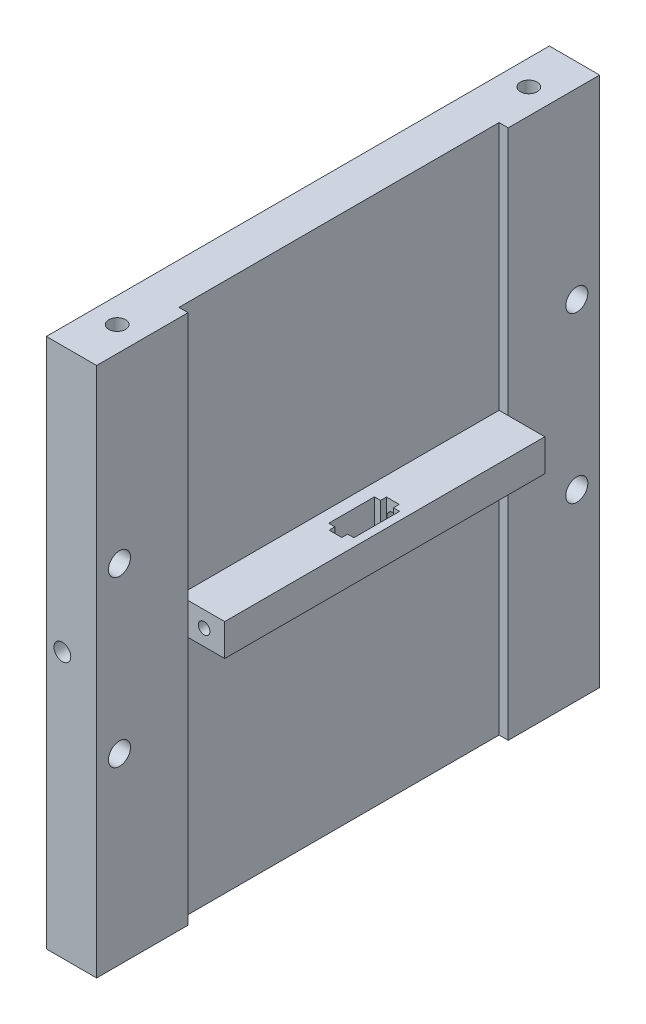
from build123d import *

# Parameters (mm, degrees)
SKETCH2_W              = 11
SKETCH2_H              = 116
BOSS_EXTRUDE2_DEPTH    = 109.999999964
SKETCH3_W              = 2
SKETCH3_H              = 70
CUT_EXTRUDE1_DEPTH     = 129.848748531
CUT_EXTRUDE2_DEPTH     = 7
CUT_EXTRUDE2_DRAFT     = -45
SKETCH6_W              = 70
SKETCH6_H              = 7
BOSS_EXTRUDE3_DEPTH    = 10
SKETCH7_R              = 1.27
CUT_EXTRUDE3_DEPTH     = 108.633637835
CUT_EXTRUDE4_DEPTH     = 84.23610994
CUT_EXTRUDE5_START     = -109.999999964
CUT_EXTRUDE5_OUTLINE_R = 1.8415
CUT_EXTRUDE5_DEPTH     = 109.999999964
SKETCH10_R             = 1.8415
CUT_EXTRUDE6_DEPTH     = 25.4
CUT_EXTRUDE7_START     = -25.4
SKETCH11_R             = 1.8415
CUT_EXTRUDE7_DEPTH     = 25.4
SKETCH12_R             = 2.413
CUT_EXTRUDE8_DEPTH     = 81.684571085


# Read off the part's stored shape, not the designer's step: Cut-Extrude5
with BuildPart() as part:
    # Sketch2 → Boss-Extrude2 (new body)
    with BuildSketch(Plane.XY.offset(54.999999982)):
        with Locations((-5.5, 0)):
            Rectangle(SKETCH2_W, SKETCH2_H)
    extrude(amount=-BOSS_EXTRUDE2_DEPTH)

    # Sketch3 → Cut-Extrude1 (cut, through all)
    with BuildSketch(Plane(origin=(0, 58, 0), x_dir=(1, 0, 0), z_dir=(0, 1, 0))):
        with Locations((-1, 1.8e-08)):
            Rectangle(SKETCH3_W, SKETCH3_H)
    extrude(amount=-CUT_EXTRUDE1_DEPTH, mode=Mode.SUBTRACT)


with BuildPart() as cut_extrude2_tool:
    # Sketch5 → Cut-Extrude2 (with draft: the straight prism first)
    with BuildSketch(Plane.ZY.offset(11)):
        with BuildLine():
            Line((-44.45, 0), (-44.45, -77.05))
            Line((-44.45, -77.05), (44.45, -77.05))
            Line((44.45, -77.05), (44.45, 0))
            ThreePointArc((44.45, 0), (0, 44.45), (-44.45, 0))
        make_face()
    extrude(amount=-CUT_EXTRUDE2_DEPTH)
    # Cut-Extrude2: the draft: its side faces are tilted about the plane it starts from
    cut_extrude2_sides = [cut_extrude2_tool.faces().sort_by_distance(p)[0] for p in [
        (-7.5, -38.525, -44.45),
        (-7.5, -77.05, 0),
        (-7.5, -38.525, 44.45),
        (-7.5, 44.45, 0),
    ]]
    draft(cut_extrude2_sides, Plane.ZY.offset(11), CUT_EXTRUDE2_DRAFT)


with BuildPart() as part_1:
    add(part.part)

    # Cut-Extrude2: cut by cut_extrude2_tool
    add(cut_extrude2_tool.part, mode=Mode.SUBTRACT)

    # Sketch6 → Boss-Extrude3 (add)
    with BuildSketch(Plane(origin=(-2, 0, 0), x_dir=(0, 0, -1), z_dir=(1, 0, 0))):
        with Locations((1.8e-08, 0)):
            Rectangle(SKETCH6_W, SKETCH6_H)
    extrude(amount=BOSS_EXTRUDE3_DEPTH)

    # Sketch7 → Cut-Extrude3 (cut, through all)
    with BuildSketch(Plane.XY.offset(34.999999982)):
        with Locations((3.5, 0)):
            Circle(SKETCH7_R)
    extrude(amount=-CUT_EXTRUDE3_DEPTH, mode=Mode.SUBTRACT)

    # Sketch8 → Cut-Extrude4 (cut, through all)
    with BuildSketch(Plane(origin=(0, 3.5, 0), x_dir=(1, 0, 0), z_dir=(0, 1, 0))):
        Polygon((0.75, 5), (0.75, -5), (2.103, -5), (2.103, -6.27), (4.897, -6.27), (4.897, -5), (6.25, -5), (6.25, 5), (4.897, 5), (4.897, 6.27), (2.103, 6.27), (2.103, 5), align=None)
    extrude(amount=-CUT_EXTRUDE4_DEPTH, mode=Mode.SUBTRACT)

    # Cut-Extrude5 outline → Cut-Extrude5 (cut)
    with BuildSketch(Plane.XY.offset(54.999999982).offset(CUT_EXTRUDE5_START)):
        with Locations((-7.5, 0)):
            Circle(CUT_EXTRUDE5_OUTLINE_R)
    extrude(amount=CUT_EXTRUDE5_DEPTH, mode=Mode.SUBTRACT)

    # Sketch10 → Cut-Extrude6 (cut)
    with BuildSketch(Plane(origin=(0, 58, 0), x_dir=(1, 0, 0), z_dir=(0, 1, 0))):
        with Locations(Location((-5.5, -44.999999982, 0), (0, 0, 270))):
            Circle(SKETCH10_R)
        with Locations(Location((-5.5, 44.999999982, 0), (0, 0, 270))):
            Circle(SKETCH10_R)
    extrude(amount=-CUT_EXTRUDE6_DEPTH, mode=Mode.SUBTRACT)

    # Sketch11 → Cut-Extrude7 (cut)
    with BuildSketch(Plane.XZ.offset(58).offset(CUT_EXTRUDE7_START)):
        with Locations(Location((-5.5, 44.999999982, 0), (0, 0, 90))):
            Circle(SKETCH11_R)
        with Locations(Location((-5.5, -44.999999982, 0), (0, 0, 90))):
            Circle(SKETCH11_R)
    extrude(amount=CUT_EXTRUDE7_DEPTH, mode=Mode.SUBTRACT)

    # Sketch12 → Cut-Extrude8 (cut, through all)
    with BuildSketch(Plane(origin=(0, 0, 0), x_dir=(0, 0, -1), z_dir=(1, 0, 0))):
        with Locations(Location((-49.999999982, 18, 0), (0, 0, 90))):
            Circle(SKETCH12_R)
        with Locations(Location((-49.999999982, -18, 0), (0, 0, 90))):
            Circle(SKETCH12_R)
        with Locations(Location((49.999999982, -18, 0), (0, 0, 90))):
            Circle(SKETCH12_R)
        with Locations(Location((49.999999982, 18, 0), (0, 0, 90))):
            Circle(SKETCH12_R)
    extrude(amount=-CUT_EXTRUDE8_DEPTH, mode=Mode.SUBTRACT)


solid = part_1.part
